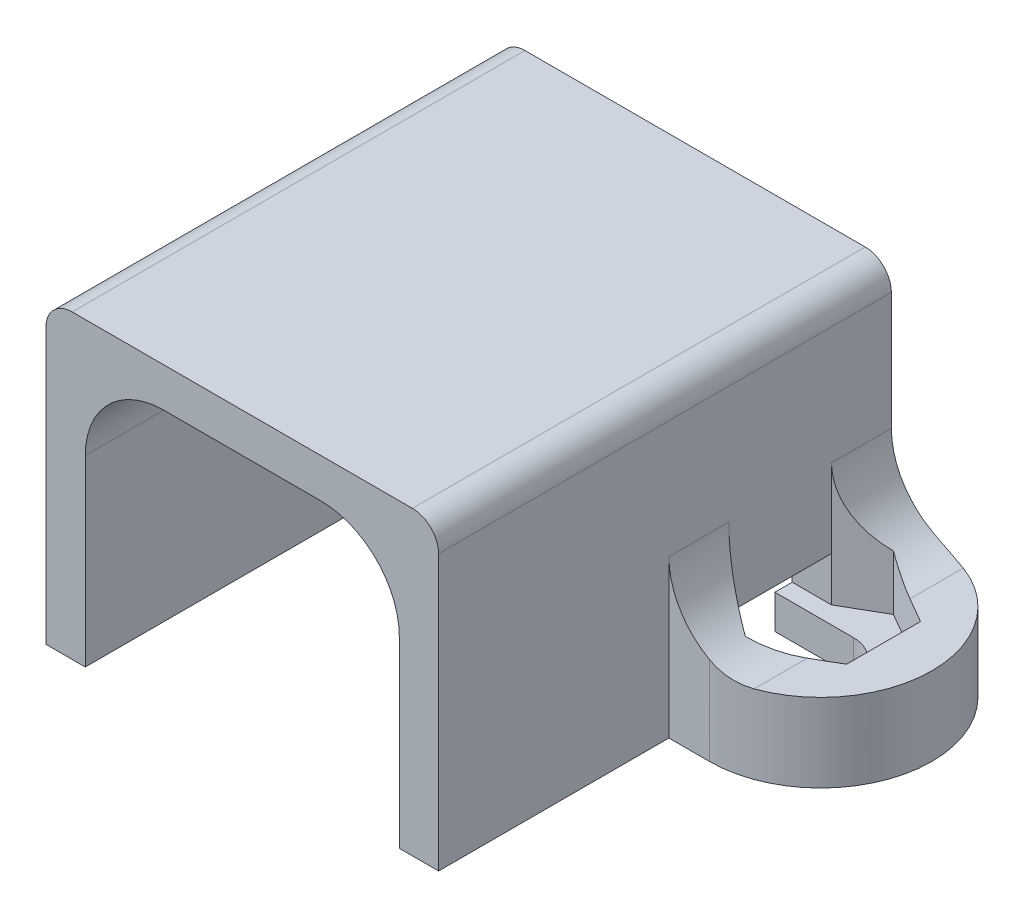
from build123d import *

# Parameters (mm, degrees)
BOSS_EXTRUDE1_DEPTH = 17.3
BOSS_EXTRUDE2_DEPTH = 3
CUT_EXTRUDE1_DEPTH  = 3
CUT_EXTRUDE2_DEPTH  = 1.7
FILLET1_DEPTH       = 17.3
FILLET1_START       = 6.212990815
FILLET1_2_DEPTH     = 2.287009185
FILLET1_3_DEPTH     = 2.287009085
FILLET1_START_2     = 3
FILLET1_4_DEPTH     = 8.5
FILLET2_R           = 1


with BuildPart() as part:
    # Sketch1 → Boss-Extrude1 (new body)
    with BuildSketch(Plane.XY):
        Polygon((6, 0), (7.5, 0), (7.5, 11.5), (-7.5, 11.5), (-7.5, 0), (-6, 0), (-6, 10), (6, 10), align=None)
    extrude(amount=BOSS_EXTRUDE1_DEPTH)

    # Sketch2 → Boss-Extrude2 (add)
    with BuildSketch(Plane.XZ):
        with BuildLine():
            Line((-7.5, 0), (-9.05, 0))
            ThreePointArc((-9.05, 0), (-13.3, 4.25), (-9.05, 8.5))
            Line((-9.05, 8.5), (-7.5, 8.5))
            Line((-7.5, 8.5), (-7.5, 0))
        make_face()
        with BuildLine():
            Line((7.5, 0), (9.05, 0))
            ThreePointArc((9.05, 0), (13.3, 4.25), (9.05, 8.5))
            Line((9.05, 8.5), (7.5, 8.5))
            Line((7.5, 8.5), (7.5, 0))
        make_face()
    extrude(amount=-BOSS_EXTRUDE2_DEPTH)

    # Sketch3 → Cut-Extrude1 (cut)
    with BuildSketch(Plane(origin=(0, 3, 0), x_dir=(1, 0, 0), z_dir=(0, 1, 0))):
        with BuildLine():
            Line((6, -2.95), (9, -2.95))
            ThreePointArc((9, -2.95), (10.3, -4.25), (9, -5.55))
            Line((9, -5.55), (6, -5.55))
            Line((6, -5.55), (6, -2.95))
        make_face()
        with BuildLine():
            Line((-6, -2.95), (-9, -2.95))
            ThreePointArc((-9, -2.95), (-10.3, -4.25), (-9, -5.55))
            Line((-9, -5.55), (-6, -5.55))
            Line((-6, -5.55), (-6, -2.95))
        make_face()
    extrude(amount=-CUT_EXTRUDE1_DEPTH, mode=Mode.SUBTRACT)

    # Sketch4 → Cut-Extrude2 (cut)
    with BuildSketch(Plane(origin=(0, 3, 0), x_dir=(1, 0, 0), z_dir=(0, 1, 0))):
        Polygon((9, -1.420983681), (7.5, -2.287009085), (6, -2.287009085), (6, -6.212990915), (7.5, -6.212990915), (9, -7.079016319), (11.45, -5.66450816), (11.45, -2.83549184), align=None)
        Polygon((-6, -6.212990915), (-7.5, -6.212990915), (-9, -7.079016319), (-11.45, -5.66450816), (-11.45, -2.83549184), (-9, -1.420983681), (-7.5, -2.287009085), (-6, -2.287009085), align=None)
    extrude(amount=-CUT_EXTRUDE2_DEPTH, mode=Mode.SUBTRACT)

    # Fillet1: read off the stored shape, not the designer's step
    # Fillet1 outline → Fillet1 (add)
    with BuildSketch(Plane.XY):
        with BuildLine():
            Line((6, 10), (3, 10))
            ThreePointArc((3, 10), (5.121320344, 9.121320344), (6, 7))
            Line((6, 7), (6, 10))
        make_face()
        with BuildLine():
            ThreePointArc((-6, 7), (-5.121320344, 9.121320344), (-3, 10))
            Line((-3, 10), (-6, 10))
            Line((-6, 10), (-6, 7))
        make_face()
    extrude(amount=FILLET1_DEPTH)

    # Fillet1 2 outline → Fillet1 2 (add)
    with BuildSketch(Plane.XY.offset(FILLET1_START)):
        with BuildLine():
            ThreePointArc((-7.5, 6), (-8.378679656, 3.878679656), (-10.5, 3))
            Line((-10.5, 3), (-7.5, 3))
            Line((-7.5, 3), (-7.5, 6))
        make_face()
        with BuildLine():
            ThreePointArc((10.5, 3), (8.378679656, 3.878679656), (7.5, 6))
            Line((7.5, 6), (7.5, 3))
            Line((7.5, 3), (10.5, 3))
        make_face()
    extrude(amount=FILLET1_2_DEPTH)

    # Fillet1 3 outline → Fillet1 3 (add)
    with BuildSketch(Plane.XY):
        with BuildLine():
            ThreePointArc((-7.5, 6), (-8.378679656, 3.878679656), (-10.5, 3))
            Line((-10.5, 3), (-7.5, 3))
            Line((-7.5, 3), (-7.5, 6))
        make_face()
        with BuildLine():
            ThreePointArc((10.5, 3), (8.378679656, 3.878679656), (7.5, 6))
            Line((7.5, 6), (7.5, 3))
            Line((7.5, 3), (10.5, 3))
        make_face()
    extrude(amount=FILLET1_3_DEPTH)

    # Fillet1 4 outline → Fillet1 4 (cut)
    with BuildSketch(Plane(origin=(0, 0, 0), x_dir=(1, 0, 0), z_dir=(0, 1, 0)).offset(FILLET1_START_2)):
        Polygon((9, -1.420983681), (7.5, -2.287009085), (10.5, -2.287009085), align=None)
        Polygon((10.5, -6.212990815), (7.5, -6.212990815), (9, -7.079016319), align=None)
        with BuildLine():
            Line((10.5, 0), (9.05, 0))
            ThreePointArc((9.05, 0), (9.786126109, -0.064236228), (10.5, -0.255003129))
            Line((10.5, -0.255003129), (10.5, 0))
        make_face()
        with BuildLine():
            ThreePointArc((10.5, -8.244996871), (9.786126109, -8.435763772), (9.05, -8.5))
            Line((9.05, -8.5), (10.5, -8.5))
            Line((10.5, -8.5), (10.5, -8.244996871))
        make_face()
        with BuildLine():
            Line((-9.05, 0), (-10.5, 0))
            Line((-10.5, 0), (-10.5, -0.255003129))
            ThreePointArc((-10.5, -0.255003129), (-9.786126109, -0.064236228), (-9.05, 0))
        make_face()
        with BuildLine():
            ThreePointArc((-9.05, -8.5), (-9.786126109, -8.435763772), (-10.5, -8.244996871))
            Line((-10.5, -8.244996871), (-10.5, -8.5))
            Line((-10.5, -8.5), (-9.05, -8.5))
        make_face()
        Polygon((-9, -1.420983681), (-10.5, -2.287009085), (-7.5, -2.287009085), align=None)
        Polygon((-7.5, -6.212990815), (-10.5, -6.212990815), (-9, -7.079016319), align=None)
    extrude(amount=FILLET1_4_DEPTH, mode=Mode.SUBTRACT)

    # Fillet2
    fillet2_edges = [part.edges().sort_by_distance(p)[0] for p in [
        (-7.5, 11.5, 8.65),
        (7.5, 11.5, 8.65),
    ]]
    fillet(fillet2_edges, radius=FILLET2_R)


solid = part.part
